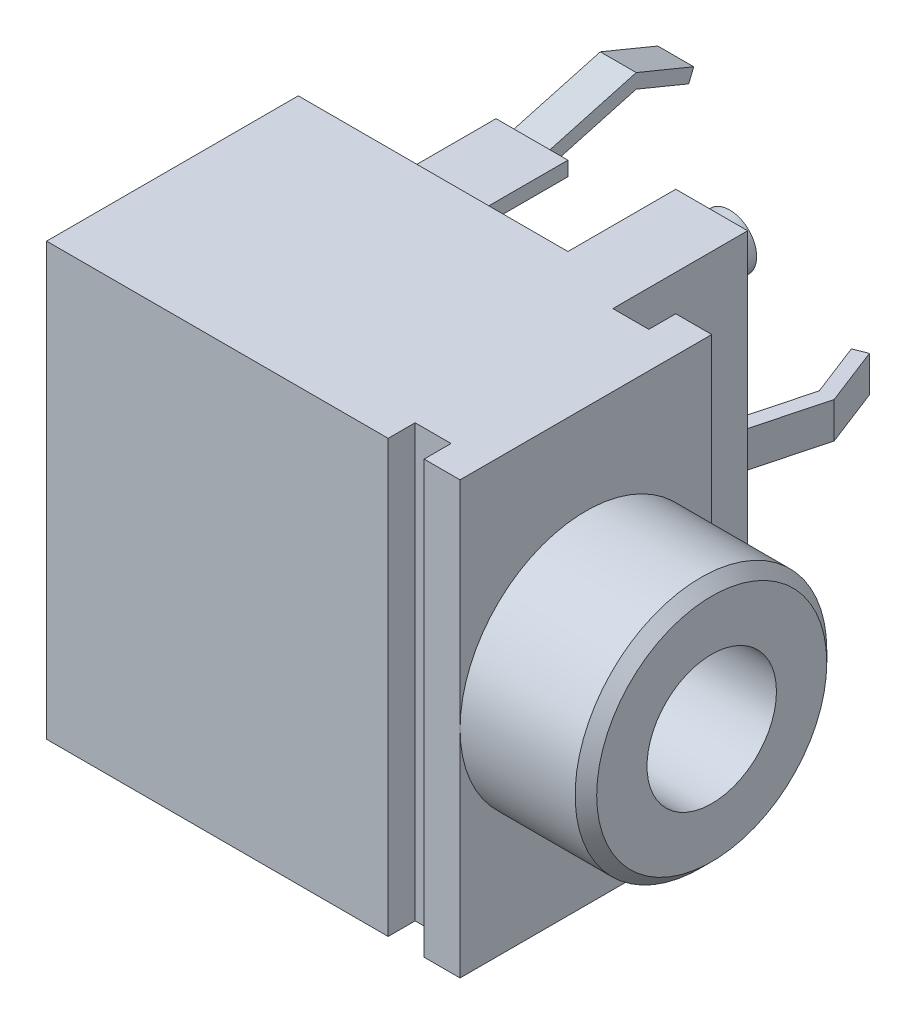
from build123d import *

# Parameters (mm, degrees)
ESBO_O1_W                        = 11.5
ESBO_O1_H                        = 12
RESSALTO_EXTRUS_O1_DEPTH         = 7
ESBO_O2_W                        = 10.5
ESBO_O2_H                        = 0.75
CORTE_EXTRUS_O1_DEPTH            = 20.52562419
ESBO_O3_W                        = 9.5
ESBO_O3_H                        = 12
RESSALTO_EXTRUS_O2_DEPTH         = 3.75
ESBO_O4_W                        = 7.5
ESBO_O4_H                        = 3
CORTE_EXTRUS_O2_DEPTH            = 21.279299791
ESBO_O5_W                        = 2
ESBO_O5_H                        = 0.4
RESSALTO_EXTRUS_O3_DEPTH         = 7
ESBO_O6_W                        = 0.5
ESBO_O6_H                        = 4
CORTE_EXTRUS_O3_DEPTH            = 21.271655088
ESBO_O7_W                        = 0.5
ESBO_O7_H                        = 4
CORTE_EXTRUS_O4_DEPTH            = 21.271655088
ESBO_O8_W                        = 4.75
ESBO_O8_H                        = 2
RESSALTO_EXTRUS_O4_DEPTH         = 3
ESBO_O9_W                        = 1
ESBO_O9_H                        = 0.75
CORTE_EXTRUS_O5_DEPTH            = 22.891779279
ESBO_O10_W                       = 2
ESBO_O10_H                       = 0.4
RESSALTO_EXTRUS_O5_DEPTH         = 3
ESBO_O11_W                       = 2
ESBO_O11_H                       = 0.4
RESSALTO_EXTRUS_O6_DEPTH         = 3
ESBO_O12_W                       = 2
ESBO_O12_H                       = 0.4
RESSALTO_EXTRUS_O7_DEPTH         = 3
ESBO_O13_W                       = 1
ESBO_O13_H                       = 0.4
RESSALTO_EXTRUS_O8_DEPTH         = 0.5
ESBO_O14_W                       = 0.75
ESBO_O14_H                       = 0.5
ESBO_O15_W                       = 0.75
ESBO_O15_H                       = 0.5
ESBO_O16_W                       = 3.5
ESBO_O16_H                       = 3.5
FURO_DE_DI_METRO_3_6_3_6_1_D     = 3.6
FURO_DE_DI_METRO_3_6_3_6_1_DEPTH = 3.5
CHANFRO1_SIZE                    = 0.3
ESBO_O19_W                       = 0.43
ESBO_O19_H                       = 1
RESSALTO_EXTRUS_O9_DEPTH         = 0.5
RESSALTO_EXTRUS_O10_DEPTH        = 0.5
RESSALTO_EXTRUS_O11_START        = -0.5
RESSALTO_EXTRUS_O11_DEPTH        = 1


with BuildPart() as part:
    # Esboço1 → Ressalto-extrusão1 (new body)
    with BuildSketch(Plane(origin=(0, 0, -3.5), x_dir=(-1, 0, 0), z_dir=(0, 0, -1))):
        with Locations((9.25, 0)):
            Rectangle(ESBO_O1_W, ESBO_O1_H)
    extrude(amount=-RESSALTO_EXTRUS_O1_DEPTH)

    # Esboço2 → Corte-extrusão1 (cut, through all)
    with BuildSketch(Plane(origin=(0, 6, 0), x_dir=(-1, 0, 0), z_dir=(0, 1, 0))):
        with Locations((9.75, -3.125)):
            Rectangle(ESBO_O2_W, ESBO_O2_H)
    extrude(amount=-CORTE_EXTRUS_O1_DEPTH, mode=Mode.SUBTRACT)

    # Esboço3 → Ressalto-extrusão2 (add)
    with BuildSketch(Plane(origin=(0, 0, -2.75), x_dir=(-1, 0, 0), z_dir=(0, 0, -1))):
        with Locations((10.25, 0)):
            Rectangle(ESBO_O3_W, ESBO_O3_H)
    extrude(amount=RESSALTO_EXTRUS_O2_DEPTH)

    # Esboço4 → Corte-extrusão2 (cut, through all)
    with BuildSketch(Plane.XZ.offset(6)):
        with Locations((-11.25, -5)):
            Rectangle(ESBO_O4_W, ESBO_O4_H)
    extrude(amount=-CORTE_EXTRUS_O2_DEPTH, mode=Mode.SUBTRACT)

    # Esboço5 → Ressalto-extrusão3 (add)
    with BuildSketch(Plane(origin=(0, 0, -3.5), x_dir=(-1, 0, 0), z_dir=(0, 0, -1))):
        with Locations((11.5, -2.5)):
            Rectangle(ESBO_O5_W, ESBO_O5_H)
    extrude(amount=RESSALTO_EXTRUS_O3_DEPTH)

    # Esboço6 → Corte-extrusão3 (cut, through all)
    with BuildSketch(Plane.XZ.offset(2.7)):
        with Locations((-10.75, -8.5)):
            Rectangle(ESBO_O6_W, ESBO_O6_H)
    extrude(amount=-CORTE_EXTRUS_O3_DEPTH, mode=Mode.SUBTRACT)

    # Esboço7 → Corte-extrusão4 (cut, through all)
    with BuildSketch(Plane.XZ.offset(2.7)):
        with Locations((-12.25, -8.5)):
            Rectangle(ESBO_O7_W, ESBO_O7_H)
    extrude(amount=-CORTE_EXTRUS_O4_DEPTH, mode=Mode.SUBTRACT)

    # Esboço8 → Ressalto-extrusão4 (add)
    with BuildSketch(Plane(origin=(0, 0, -3.5), x_dir=(-1, 0, 0), z_dir=(0, 0, -1))):
        with Locations((9.875, 0)):
            Rectangle(ESBO_O8_W, ESBO_O8_H)
    extrude(amount=RESSALTO_EXTRUS_O4_DEPTH)

    # Esboço9 → Corte-extrusão5 (cut, through all)
    with BuildSketch(Plane.XZ.offset(6)):
        with Locations((-5, 3.125)):
            Rectangle(ESBO_O9_W, ESBO_O9_H)
    extrude(amount=-CORTE_EXTRUS_O5_DEPTH, mode=Mode.SUBTRACT)

    # Esboço10 → Ressalto-extrusão5 (add)
    with BuildSketch(Plane(origin=(0, 0, -3.5), x_dir=(-1, 0, 0), z_dir=(0, 0, -1))):
        with Locations((11.5, 5)):
            Rectangle(ESBO_O10_W, ESBO_O10_H)
    extrude(amount=RESSALTO_EXTRUS_O5_DEPTH)

    # Esboço11 → Ressalto-extrusão6 (add)
    with BuildSketch(Plane(origin=(0, 0, -3.5), x_dir=(-1, 0, 0), z_dir=(0, 0, -1))):
        with Locations((11.5, -5)):
            Rectangle(ESBO_O11_W, ESBO_O11_H)
    extrude(amount=RESSALTO_EXTRUS_O6_DEPTH)

    # Esboço12 → Ressalto-extrusão7 (add)
    with BuildSketch(Plane(origin=(0, 0, -3.5), x_dir=(-1, 0, 0), z_dir=(0, 0, -1))):
        with Locations((11.5, 2.5)):
            Rectangle(ESBO_O12_W, ESBO_O12_H)
    extrude(amount=RESSALTO_EXTRUS_O7_DEPTH)

    # Esboço13 → Ressalto-extrusão8 (add)
    with BuildSketch(Plane(origin=(0, 0, -6.5), x_dir=(-1, 0, 0), z_dir=(0, 0, -1))):
        with Locations((11.5, 0)):
            Rectangle(ESBO_O13_W, ESBO_O13_H)
    extrude(amount=RESSALTO_EXTRUS_O8_DEPTH)

    # Esboço14 → Revolução1 (revolve)
    with BuildSketch(Plane(origin=(0, -5, 0), x_dir=(1, 0, 0), z_dir=(0, 1, 0))):
        with Locations((-6.125, 6.75)):
            Rectangle(ESBO_O14_W, ESBO_O14_H)
    revolve(axis=Axis((-6.5, -5, -7), (0, 0, 1)))

    # Esboço15 → Revolução2 (revolve)
    with BuildSketch(Plane(origin=(0, 5, 0), x_dir=(1, 0, 0), z_dir=(0, 1, 0))):
        with Locations((-6.125, 6.75)):
            Rectangle(ESBO_O15_W, ESBO_O15_H)
    revolve(axis=Axis((-6.5, 5, -7), (0, 0, 1)))

    # Esboço16 → Revolução3 (revolve)
    with BuildSketch(Plane(origin=(0, 0, 0), x_dir=(-1, 0, 0), z_dir=(0, 0, -1))):
        with Locations((1.75, 1.75)):
            Rectangle(ESBO_O16_W, ESBO_O16_H)
    revolve(axis=Axis((0, 0, 0), (-1, 0, 0)))

    # Furo de diâmetro Ø3.6 (3.6)1
    with Locations(Plane(origin=(0, 0, 0), x_dir=(0, 0, -1), z_dir=(1, 0, 0))):
        with Locations((0, 0)):
            Hole(FURO_DE_DI_METRO_3_6_3_6_1_D / 2, depth=FURO_DE_DI_METRO_3_6_3_6_1_DEPTH)

    # Chanfro1
    chanfro1_edges = [part.edges().sort_by_distance(p)[0] for p in [
        (0, -3.5, 0),
    ]]
    chamfer(chanfro1_edges, length=CHANFRO1_SIZE)

    # Esboço19 → Ressalto-extrusão9 (add)
    with BuildSketch(Plane(origin=(0, 0, -6.5), x_dir=(-1, 0, 0), z_dir=(0, 0, -1))):
        with Locations((6.505, 0)):
            Rectangle(ESBO_O19_W, ESBO_O19_H)
    extrude(amount=RESSALTO_EXTRUS_O9_DEPTH)

    # Esboço20 → Ressalto-extrusão10 (add, symmetric)
    with BuildSketch(Plane(origin=(0, 0, 0), x_dir=(1, 0, 0), z_dir=(0, 1, 0))):
        Polygon((-6.302158206, 6.98750552), (-5.732158206, 9.13750552), (-6.352158206, 10.73750552), (-6.713447386, 10.597505963), (-6.147697214, 9.13750552), (-6.717697214, 6.98750552), align=None)
    extrude(amount=RESSALTO_EXTRUS_O10_DEPTH, both=True)

    # Esboço21 → Ressalto-extrusão11 (add)
    with BuildSketch(Plane.ZY.offset(12.5).offset(RESSALTO_EXTRUS_O11_START)):
        Polygon((-6.5, 5.2), (-8.9, 5.86), (-10.5, 5.2), (-10.35899319, 4.858165309), (-8.9, 5.46), (-6.5, 4.8), align=None)
    ressalto_extrus_o11 = extrude(amount=-RESSALTO_EXTRUS_O11_DEPTH)

    # Espelhar1: Ressalto-extrusão11 across plane
    add(ressalto_extrus_o11.mirror(Plane.ZX))


solid = part.part
